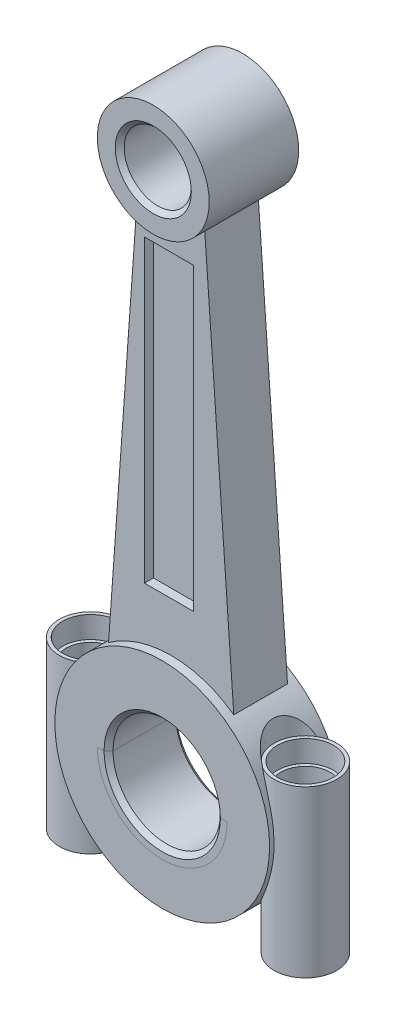
from build123d import *

# Parameters (mm, degrees)
SKETCH1_R                                = 12.5
SKETCH1_R_2                              = 7.5
SKETCH1_R_3                              = 24
SKETCH1_R_4                              = 12
BOSS_EXTRUDE1_DEPTH                      = 6
SKETCH2_R                                = 24
SKETCH2_R_2                              = 12
BOSS_EXTRUDE3_DEPTH                      = 8
SKETCH3_R                                = 12.5
SKETCH3_R_2                              = 7.5
BOSS_EXTRUDE4_DEPTH                      = 10
SKETCH5_R                                = 7
BOSS_EXTRUDE5_DEPTH                      = 37
CUT_EXTRUDE1_START                       = -37
SKETCH5_2_R                              = 7
CUT_EXTRUDE1_DEPTH                       = 37
CUT_EXTRUDE1_DRAFT                       = 3
CUT_EXTRUDE1_PROFILE_2_DEPTH             = 37
CUT_EXTRUDE1_PROFILE_2_DRAFT             = 3
CBORE_FOR_M10_HEX_HEAD_BOLT2_D           = 11
CBORE_FOR_M10_HEX_HEAD_BOLT2_DEPTH       = 42.4
CBORE_FOR_M10_HEX_HEAD_BOLT2_CBORE_D     = 12.48
CBORE_FOR_M10_HEX_HEAD_BOLT2_CBORE_DEPTH = 4.85
CBORE_FOR_M10_HEX_HEAD_BOLT2_TIP         = 3.304733405
SKETCH10_W                               = 11
SKETCH10_H                               = 67
CUT_EXTRUDE2_DEPTH                       = 2
SKETCH11_W                               = 11
SKETCH11_H                               = 67
CUT_EXTRUDE3_DEPTH                       = 2
CHAMFER1_SIZE                            = 1
CHAMFER2_SIZE                            = 1
SPLIT1_START                             = -8
SPLIT1_DEPTH                             = 16
SPLIT1_2_ANGLE                           = 180


# Read off the part's stored shape, not the designer's step: Split1
with BuildPart() as part:
    # Sketch1 → Boss-Extrude1 (new, symmetric)
    # profile 1 of 3: a face of its own
    with BuildSketch(Plane.XY):
        with Locations((0, 86.495427945)):
            Circle(SKETCH1_R)
        with Locations((0, 86.495427945)):
            Circle(SKETCH1_R_2, mode=Mode.SUBTRACT)
    # profile 2 of 3: a face of its own
    with BuildSketch(Plane.XY):
        with Locations((0, -33.504572055)):
            Circle(SKETCH1_R_3)
        with Locations((0, -33.504572055)):
            Circle(SKETCH1_R_4, mode=Mode.SUBTRACT)
    # profile 3 of 3: a face of its own
    with BuildSketch(Plane.XY):
        with BuildLine():
            Line((-7.5, 76.495427945), (-14, -14.010983366))
            ThreePointArc((-14, -14.010983366), (0, -9.504572055), (14, -14.010983366))
            Line((14, -14.010983366), (7.5, 76.495427945))
            ThreePointArc((7.5, 76.495427945), (0, 73.995427945), (-7.5, 76.495427945))
        make_face()
    extrude(amount=BOSS_EXTRUDE1_DEPTH, both=True)

    # Sketch2 → Boss-Extrude3 (add, symmetric)
    with BuildSketch(Plane.XY):
        with Locations((0, -33.504572055)):
            Circle(SKETCH2_R)
        with Locations((0, -33.504572055)):
            Circle(SKETCH2_R_2, mode=Mode.SUBTRACT)
    extrude(amount=BOSS_EXTRUDE3_DEPTH, both=True)

    # Sketch3 → Boss-Extrude4 (add, symmetric)
    with BuildSketch(Plane.XY):
        with Locations((0, 86.495427945)):
            Circle(SKETCH3_R)
        with Locations((0, 86.495427945)):
            Circle(SKETCH3_R_2, mode=Mode.SUBTRACT)
    extrude(amount=BOSS_EXTRUDE4_DEPTH, both=True)

    # Sketch5 → Boss-Extrude5 (add)
    with BuildSketch(Plane(origin=(0, -58, 0), x_dir=(-1, 0, 0), z_dir=(0, -1, 0))):
        with Locations(Location((-24, 0, 0), (0, 0, 180))):
            Circle(SKETCH5_R)
        with Locations(Location((24, 0, 0), (0, 0, 180))):
            Circle(SKETCH5_R)
    extrude(amount=-BOSS_EXTRUDE5_DEPTH)


with BuildPart() as cut_extrude1_tool:
    # Sketch5<2> → Cut-Extrude1 (with draft: the straight prism first)
    with BuildSketch(Plane(origin=(0, -58, 0), x_dir=(-1, 0, 0), z_dir=(0, -1, 0)).offset(CUT_EXTRUDE1_START)):
        with Locations(Location((-24, 0, 0), (0, 0, 180))):
            Circle(SKETCH5_2_R)
    extrude(amount=-CUT_EXTRUDE1_DEPTH)
    # Cut-Extrude1: the draft: its side faces are tilted about the plane it starts from
    cut_extrude1_sides = [cut_extrude1_tool.faces().sort_by_distance(p)[0] for p in [
        (17, -2.5, 0),
    ]]
    draft(cut_extrude1_sides, Plane(origin=(0, -58, 0), x_dir=(-1, 0, 0), z_dir=(0, -1, 0)).offset(CUT_EXTRUDE1_START), CUT_EXTRUDE1_DRAFT)


with BuildPart() as part_1:
    add(part.part)

    # Cut-Extrude1: cut by cut_extrude1_tool
    add(cut_extrude1_tool.part, mode=Mode.SUBTRACT)


with BuildPart() as cut_extrude1_profile_2_tool:
    # Sketch5<2> → Cut-Extrude1 profile 2 (with draft: the straight prism first)
    with BuildSketch(Plane(origin=(0, -58, 0), x_dir=(-1, 0, 0), z_dir=(0, -1, 0)).offset(CUT_EXTRUDE1_START)):
        with Locations(Location((24, 0, 0), (0, 0, 180))):
            Circle(SKETCH5_2_R)
    extrude(amount=-CUT_EXTRUDE1_PROFILE_2_DEPTH)
    # Cut-Extrude1 profile 2: the draft: its side faces are tilted about the plane it starts from
    cut_extrude1_profile_2_sides = [cut_extrude1_profile_2_tool.faces().sort_by_distance(p)[0] for p in [
        (-31, -2.5, 0),
    ]]
    draft(cut_extrude1_profile_2_sides, Plane(origin=(0, -58, 0), x_dir=(-1, 0, 0), z_dir=(0, -1, 0)).offset(CUT_EXTRUDE1_START), CUT_EXTRUDE1_PROFILE_2_DRAFT)


with BuildPart() as part_2:
    add(part_1.part)

    # Cut-Extrude1 profile 2: cut by cut_extrude1_profile_2_tool
    add(cut_extrude1_profile_2_tool.part, mode=Mode.SUBTRACT)

    # CBORE for M10 Hex Head Bolt2
    with Locations(Plane(origin=(0, -21, 0), x_dir=(1, 0, 0), z_dir=(0, 1, 0))):
        with Locations((-24, 0), (24, 0)):
            CounterBoreHole(CBORE_FOR_M10_HEX_HEAD_BOLT2_D / 2, CBORE_FOR_M10_HEX_HEAD_BOLT2_CBORE_D / 2, CBORE_FOR_M10_HEX_HEAD_BOLT2_CBORE_DEPTH, depth=CBORE_FOR_M10_HEX_HEAD_BOLT2_DEPTH)
            with Locations((0, 0, -(CBORE_FOR_M10_HEX_HEAD_BOLT2_DEPTH + CBORE_FOR_M10_HEX_HEAD_BOLT2_TIP / 2))):  # 118° drill point
                Cone(0, CBORE_FOR_M10_HEX_HEAD_BOLT2_D / 2, CBORE_FOR_M10_HEX_HEAD_BOLT2_TIP, mode=Mode.SUBTRACT)

    # Sketch10 → Cut-Extrude2 (cut)
    with BuildSketch(Plane(origin=(0, 0, -6), x_dir=(-1, 0, 0), z_dir=(0, 0, -1))):
        with Locations((0.245421027, 35)):
            Rectangle(SKETCH10_W, SKETCH10_H)
    extrude(amount=-CUT_EXTRUDE2_DEPTH, mode=Mode.SUBTRACT)

    # Sketch11 → Cut-Extrude3 (cut)
    with BuildSketch(Plane.XY.offset(6)):
        with Locations((-0.464361818, 35)):
            Rectangle(SKETCH11_W, SKETCH11_H)
    extrude(amount=-CUT_EXTRUDE3_DEPTH, mode=Mode.SUBTRACT)

    # Chamfer1
    chamfer1_edges = [part_2.edges().sort_by_distance(p)[0] for p in [
        (-12, -33.504572055, -8),
        (-12, -33.504572055, 8),
    ]]
    chamfer(chamfer1_edges, length=CHAMFER1_SIZE)

    # Chamfer2
    chamfer2_edges = [part_2.edges().sort_by_distance(p)[0] for p in [
        (-7.5, 86.495427945, -10),
        (-7.5, 86.495427945, 10),
    ]]
    chamfer(chamfer2_edges, length=CHAMFER2_SIZE)

    # Split1 outline → Split1 (cut)
    with BuildSketch(Plane.XY.offset(SPLIT1_START)):
        with BuildLine():
            Line((-12, -33.504572055), (-14.5, -33.504572055))
            ThreePointArc((-14.5, -33.504572055), (0, -48.004572055), (14.5, -33.504572055))
            Line((14.5, -33.504572055), (12, -33.504572055))
            ThreePointArc((12, -33.504572055), (0, -45.504572055), (-12, -33.504572055))
        make_face()
    extrude(amount=SPLIT1_DEPTH, mode=Mode.SUBTRACT)


with BuildPart() as body_2:
    # Split1 2 outline → Split1 2 (revolve)
    with BuildSketch(Plane(origin=(0, -33.504572055, 0), x_dir=(-1, 0, 0), z_dir=(0, 1, 0))):
        Polygon((13, -8), (14.5, -8), (14.5, 8), (13, 8), (12, 7), (12, -7), align=None)
    revolve(axis=Axis((0, -33.504572055, 0), (0, 0, 1)), revolution_arc=SPLIT1_2_ANGLE)


solid = Compound([part_2.part, body_2.part])
